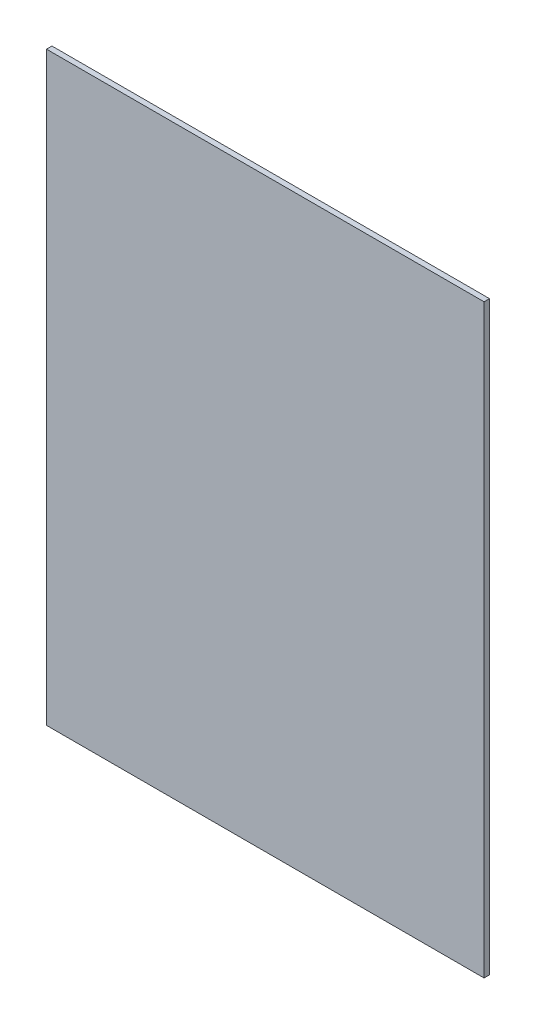
from build123d import *

# Parameters (mm, degrees)
SKETCH1_W           = 510.54
SKETCH1_H           = 683.26
BOSS_EXTRUDE1_DEPTH = 6.35


with BuildPart() as part:
    # Sketch1 → Boss-Extrude1 (new body)
    with BuildSketch(Plane.XY):
        with Locations((255.27, 341.63)):
            Rectangle(SKETCH1_W, SKETCH1_H)
    extrude(amount=BOSS_EXTRUDE1_DEPTH)


solid = part.part
